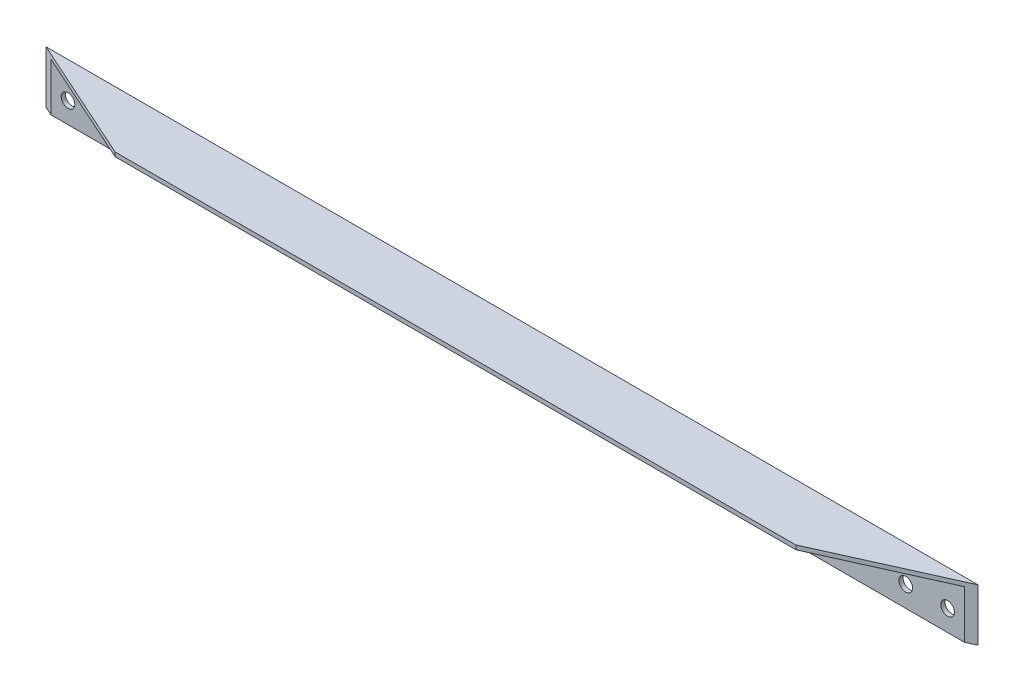
from build123d import *

# Parameters (mm, degrees)
SKETCH_1_W          = 1780
SKETCH_1_H          = 100
SKETCH_1_R          = 13
EXTRUDE_497_DEPTH   = 8
SKETCH_2_W          = 1780
SKETCH_2_H          = 8
EXTRUDE_1_DEPTH     = 100
CUT_EXTRUDE_1_DEPTH = 903.088687436


with BuildPart() as part:
    # 草图1 → Extrude 497 (new body)
    with BuildSketch(Plane.XY):
        with Locations((0, 50)):
            Rectangle(SKETCH_1_W, SKETCH_1_H)
        with Locations((840, 40)):
            Circle(SKETCH_1_R, mode=Mode.SUBTRACT)
        with Locations((760, 40)):
            Circle(SKETCH_1_R, mode=Mode.SUBTRACT)
        with Locations((-840, 40)):
            Circle(SKETCH_1_R, mode=Mode.SUBTRACT)
        with Locations((-760, 40)):
            Circle(SKETCH_1_R, mode=Mode.SUBTRACT)
    extrude(amount=EXTRUDE_497_DEPTH)

    # 草图2 → 凸台-拉伸1 (add)
    with BuildSketch(Plane.XY.offset(8)):
        with Locations((0, 96)):
            Rectangle(SKETCH_2_W, SKETCH_2_H)
    extrude(amount=EXTRUDE_1_DEPTH)

    # 草图3 → 切除-拉伸1 (cut, through all)
    with BuildSketch(Plane(origin=(0, 100, 0), x_dir=(-1, 0, 0), z_dir=(0, 1, 0))):
        Polygon((-650, 108), (-890, 0), (-890, 108), align=None)
        Polygon((890, 108), (650, 108), (890, 0), align=None)
    extrude(amount=-CUT_EXTRUDE_1_DEPTH, mode=Mode.SUBTRACT)


solid = part.part
